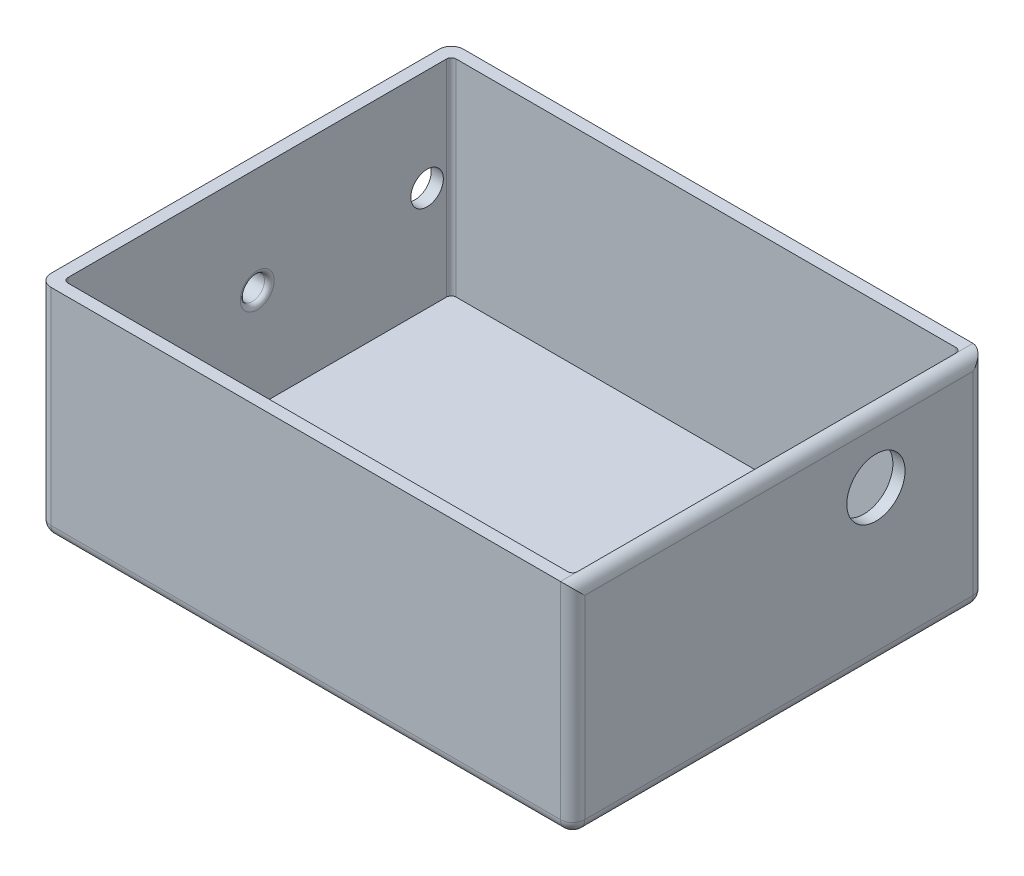
from build123d import *

# Parameters (mm, degrees)
SKETCH1_W           = 110
SKETCH1_H           = 85
BOSS_EXTRUDE1_DEPTH = 45
SKETCH2_W           = 105
SKETCH2_H           = 80
CUT_EXTRUDE1_DEPTH  = 42.5
FILLET1_R           = 2.5
SKETCH3_R           = 3.75
BOSS_EXTRUDE3_DEPTH = 2.5
SKETCH5_R           = 2.5
CUT_EXTRUDE2_DEPTH  = 30
FILLET2_R           = 2.5
FILLET3_R           = 1
FILLET4_R           = 1
SKETCH12_R          = 6
CUT_EXTRUDE3_DEPTH  = 30
SKETCH13_R          = 3.35
CUT_EXTRUDE4_DEPTH  = 30


# Read off the part's stored shape, not the designer's step: Cut-Sweep1
# Some blends are built 0.0001 mm under size
with BuildPart() as part:
    # Sketch1 → Boss-Extrude1 (new body)
    with BuildSketch(Plane(origin=(0, 0, 0), x_dir=(1, 0, 0), z_dir=(0, 1, 0))):
        Rectangle(SKETCH1_W, SKETCH1_H)
    extrude(amount=BOSS_EXTRUDE1_DEPTH)

    # Sketch2 → Cut-Extrude1 (cut)
    with BuildSketch(Plane(origin=(0, 45, 0), x_dir=(1, 0, 0), z_dir=(0, 1, 0))):
        Rectangle(SKETCH2_W, SKETCH2_H)
    extrude(amount=-CUT_EXTRUDE1_DEPTH, mode=Mode.SUBTRACT)

    # Fillet1
    fillet1_edges = [part.edges().sort_by_distance(p)[0] for p in [
        (55, 45, 0),
        (0, 0, 42.5),
        (-55, 0, 0),
        (0, 0, -42.5),
        (55, 0, 0),
        (55, 22.5, 42.5),
        (-55, 22.5, 42.5),
        (-55, 22.5, -42.5),
        (55, 22.5, -42.5),
    ]]
    fillet(fillet1_edges, radius=FILLET1_R - 0.0001)  # a hair under: the kernel refuses the full size

    # Sketch3 → Boss-Extrude3 (add)
    with BuildSketch(Plane.ZY.offset(55)):
        with Locations(Location((0, 23.219153855, 0), (0, 0, 180))):
            Circle(SKETCH3_R)
    extrude(amount=BOSS_EXTRUDE3_DEPTH)

    # Sketch5 → Cut-Extrude2 (cut)
    with BuildSketch(Plane.ZY.offset(57.5)):
        with Locations((0, 23.219153855)):
            Circle(SKETCH5_R)
    extrude(amount=-CUT_EXTRUDE2_DEPTH, mode=Mode.SUBTRACT)

    # Cut-Sweep1 outline → Cut-Sweep1 (revolve, cut)
    with BuildSketch(Plane(origin=(0, 23.219153855, 0), x_dir=(0, 1, 0), z_dir=(0, 0, -1))):
        with BuildLine():
            ThreePointArc((3.75, -56.25), (2.866116524, -56.616116524), (2.5, -57.5))
            Line((2.5, -57.5), (3.75, -57.5))
            Line((3.75, -57.5), (3.75, -56.25))
        make_face()
    revolve(axis=Axis((0, 23.219153855, 0), (1, 0, 0)), mode=Mode.SUBTRACT)

    # Fillet2
    # the kernel refuses this fillet: 2.5 mm, written as the material it adds along each edge
    with BuildSketch(Plane(origin=(-55, 23.219153855, 0), x_dir=(0, 0, -1), z_dir=(0, 1, 0))) as fillet2_piece_1:
        with BuildLine():
            CenterArc((5.915063509, 2.5), FILLET2_R, 210, 60)
            Line((3.75, 1.25), (3.70669873, 1.225))
            ThreePointArc((3.70669873, 1.225), (3.7, 0.625), (3.7, 0))
            Line((3.7, 0), (3.75, -0.05))
            Line((3.75, -0.05), (5.915063509, -0.05))
            Line((5.915063509, -0.05), (5.915063509, 0))
        make_face()
    revolve(axis=Axis((-55, 23.219153855, 0), (-1, 0, 0)))

    # Fillet3
    fillet3_edges = [part.edges().sort_by_distance(p)[0] for p in [
        (-52.5, 23.219153855, -2.5),
    ]]
    fillet(fillet3_edges, radius=FILLET3_R)

    # Fillet4
    fillet4_edges = [part.edges().sort_by_distance(p)[0] for p in [
        (52.5, 23.75, -40),
        (52.5, 23.75, 40),
        (-52.5, 23.75, 40),
        (-52.5, 23.75, -40),
    ]]
    fillet(fillet4_edges, radius=FILLET4_R)

    # Sketch12 → Cut-Extrude3 (cut)
    with BuildSketch(Plane(origin=(55, 0, 0), x_dir=(0, 0, -1), z_dir=(1, 0, 0))):
        with Locations((20, 31.765581052)):
            Circle(SKETCH12_R)
    extrude(amount=-CUT_EXTRUDE3_DEPTH, mode=Mode.SUBTRACT)

    # Sketch13 → Cut-Extrude4 (cut)
    with BuildSketch(Plane.ZY.offset(55)):
        with Locations((-35, 23.964639065)):
            Circle(SKETCH13_R)
    extrude(amount=-CUT_EXTRUDE4_DEPTH, mode=Mode.SUBTRACT)


solid = part.part
